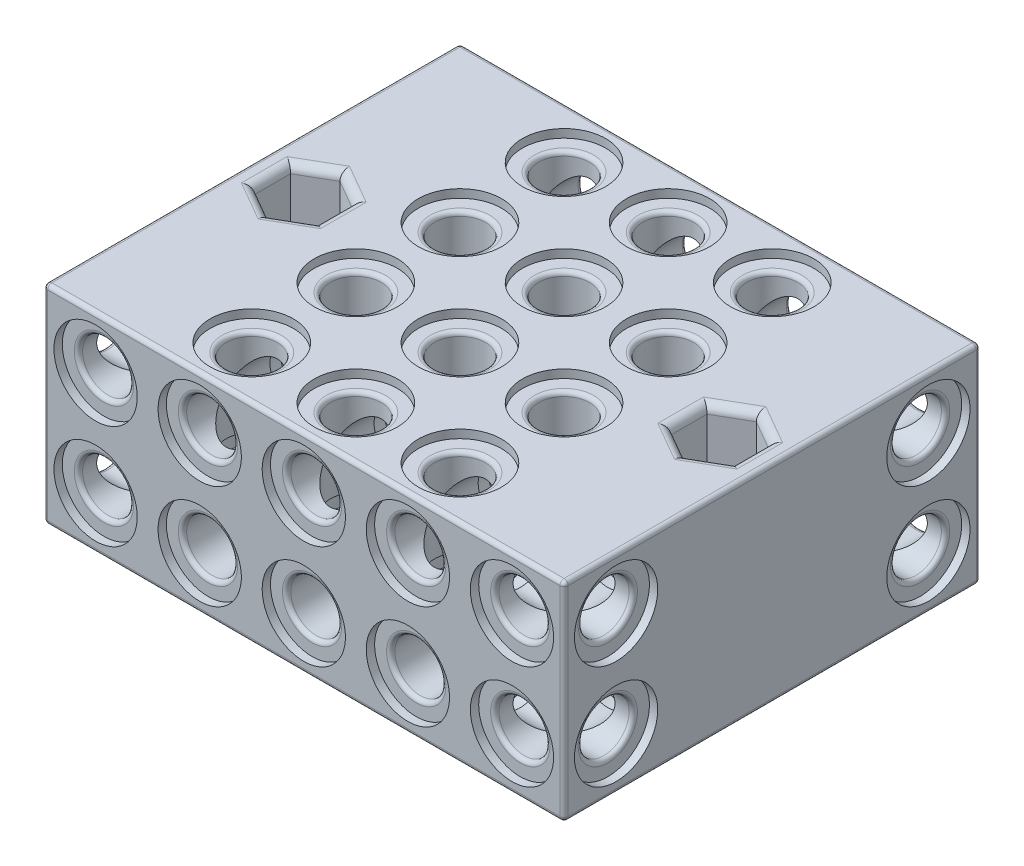
from build123d import *

# Parameters (mm, degrees)
SKETCH1_W              = 50
SKETCH1_H              = 40
BOSS_EXTRUDE1_DEPTH    = 20
SKETCH2_R              = 1.6
CUT_EXTRUDE1_DEPTH     = 38.749172176
CUT_EXTRUDE2_DEPTH     = 17
SKETCH4_R              = 2.45
CUT_EXTRUDE3_DEPTH     = 9.2
SKETCH6_R              = 3
CUT_EXTRUDE5_DEPTH     = 1.5
SKETCH7_R              = 4
CUT_EXTRUDE6_DEPTH     = 0.8
FILLET1_R              = 0.4
LPATTERN1_COUNT        = 4
LPATTERN1_PITCH        = 10
LPATTERN1_COUNT_DIR2   = 2
LPATTERN1_PITCH_DIR2   = 10
FILLET1_OF_LPATTERN1_R = 0.4
SKETCH5_R              = 2.45
CUT_EXTRUDE4_DEPTH     = 9.2
SKETCH8_R              = 3
CUT_EXTRUDE7_DEPTH     = 1.5
SKETCH9_R              = 4
CUT_EXTRUDE8_DEPTH     = 0.8
FILLET2_R              = 0.4
LPATTERN2_COUNT        = 5
LPATTERN2_PITCH        = 10
LPATTERN2_COUNT_DIR2   = 2
LPATTERN2_PITCH_DIR2   = 10
FILLET2_OF_LPATTERN2_R = 0.4
MIRROR2_START          = 9.3
MIRROR2_OUTLINE_R      = 2.45
MIRROR2_DEPTH          = 8.1500001
MIRROR2_2_OUTLINE_R    = 3
MIRROR2_2_OUTLINE_R_2  = 2.45
MIRROR2_2_DEPTH        = 1.5
FILLET3_R              = 0.8
SKETCH10_R             = 2.45
CUT_EXTRUDE9_DEPTH     = 9.2
SKETCH11_R             = 3
CUT_EXTRUDE10_DEPTH    = 1.5
SKETCH12_R             = 4
CUT_EXTRUDE11_DEPTH    = 0.8
FILLET4_R              = 0.4
LPATTERN3_COUNT        = 3
LPATTERN3_PITCH        = 10
LPATTERN3_COUNT_DIR2   = 4
LPATTERN3_PITCH_DIR2   = 10
FILLET4_OF_LPATTERN3_R = 0.4
FILLET5_R              = 0.4


# Read off the part's stored shape, not the designer's step: Mirror1, Mirror2
with BuildPart() as part:
    # Sketch1 → Boss-Extrude1 (new body)
    with BuildSketch(Plane(origin=(0, 0, 0), x_dir=(1, 0, 0), z_dir=(0, 1, 0))):
        Rectangle(SKETCH1_W, SKETCH1_H)
    extrude(amount=BOSS_EXTRUDE1_DEPTH)

    # Sketch2 → Cut-Extrude1 (cut, through all)
    with BuildSketch(Plane.XZ):
        with Locations(Location((-20, 0, 0), (0, 0, 270))):
            Circle(SKETCH2_R)
        with Locations(Location((20, 0, 0), (0, 0, 270))):
            Circle(SKETCH2_R)
    extrude(amount=-CUT_EXTRUDE1_DEPTH, mode=Mode.SUBTRACT)

    # Sketch3 → Cut-Extrude2 (cut)
    with BuildSketch(Plane(origin=(0, 20, 0), x_dir=(1, 0, 0), z_dir=(0, 1, 0))):
        Polygon((-20, 3.464101615), (-23, 1.732050808), (-23, -1.732050808), (-20, -3.464101615), (-17, -1.732050808), (-17, 1.732050808), align=None)
        Polygon((17, 1.732050808), (17, -1.732050808), (20, -3.464101615), (23, -1.732050808), (23, 1.732050808), (20, 3.464101615), align=None)
    extrude(amount=-CUT_EXTRUDE2_DEPTH, mode=Mode.SUBTRACT)

    # Sketch4 → Cut-Extrude3 (cut)
    with BuildSketch(Plane.ZY.offset(25)):
        with Locations((-15, 15)):
            Circle(SKETCH4_R)
    cut_extrude3 = extrude(amount=-CUT_EXTRUDE3_DEPTH, mode=Mode.SUBTRACT)

    # Sketch6 → Cut-Extrude5 (cut)
    with BuildSketch(Plane.ZY.offset(15.8)):
        with Locations((-15, 15)):
            Circle(SKETCH6_R)
    cut_extrude5 = extrude(amount=-CUT_EXTRUDE5_DEPTH, mode=Mode.SUBTRACT)

    # Sketch7 → Cut-Extrude6 (cut)
    with BuildSketch(Plane.ZY.offset(25)):
        with Locations((-15, 15)):
            Circle(SKETCH7_R)
    cut_extrude6 = extrude(amount=-CUT_EXTRUDE6_DEPTH, mode=Mode.SUBTRACT)

    # Fillet1
    fillet1_edges = [part.edges().sort_by_distance(p)[0] for p in [
        (-24.2, 15, -17.45),
    ]]
    fillet(fillet1_edges, radius=FILLET1_R)

    # LPattern1: Cut-Extrude3, Cut-Extrude5, Cut-Extrude6 4 × 2, 4 skipped
    with Locations(*[(0, -j * LPATTERN1_PITCH_DIR2, i * LPATTERN1_PITCH) for i in range(LPATTERN1_COUNT) for j in range(LPATTERN1_COUNT_DIR2) if (i, j) not in ((0, 0), (1, 0), (1, 1), (2, 0), (2, 1))]):
        add(cut_extrude3, mode=Mode.SUBTRACT)
        add(cut_extrude5, mode=Mode.SUBTRACT)
        add(cut_extrude6, mode=Mode.SUBTRACT)

    # Fillet1 of LPattern1
    fillet1_of_lpattern1_edges = [part.edges().sort_by_distance(p)[0] for p in [
        (-24.2, 5, -17.45),
        (-24.2, 15, 12.55),
        (-24.2, 5, 12.55),
    ]]
    fillet(fillet1_of_lpattern1_edges, radius=FILLET1_OF_LPATTERN1_R)

    # Mirror1 outline → Mirror1 (revolve, cut)
    with BuildSketch(Plane(origin=(0, 15, -15), x_dir=(0, 1, 0), z_dir=(0, 0, -1))):
        with BuildLine():
            Line((4, 24.2), (4, 25))
            Line((4, 25), (0, 25))
            Line((0, 25), (0, 14.3))
            Line((0, 14.3), (3, 14.3))
            Line((3, 14.3), (3, 15.8))
            Line((3, 15.8), (2.45, 15.8))
            Line((2.45, 15.8), (2.45, 23.8))
            ThreePointArc((2.45, 23.8), (2.567157288, 24.082842712), (2.85, 24.2))
            Line((2.85, 24.2), (4, 24.2))
        make_face()
    revolve(axis=Axis((0, 15, -15), (1, 0, 0)), mode=Mode.SUBTRACT)

    # Mirror1 2 outline → Mirror1 2 (revolve, cut)
    with BuildSketch(Plane(origin=(0, 5, -15), x_dir=(0, 1, 0), z_dir=(0, 0, -1))):
        with BuildLine():
            Line((4, 24.2), (4, 25))
            Line((4, 25), (0, 25))
            Line((0, 25), (0, 14.3))
            Line((0, 14.3), (3, 14.3))
            Line((3, 14.3), (3, 15.8))
            Line((3, 15.8), (2.45, 15.8))
            Line((2.45, 15.8), (2.45, 23.8))
            ThreePointArc((2.45, 23.8), (2.567157288, 24.082842712), (2.85, 24.2))
            Line((2.85, 24.2), (4, 24.2))
        make_face()
    revolve(axis=Axis((0, 5, -15), (1, 0, 0)), mode=Mode.SUBTRACT)

    # Mirror1 3 outline → Mirror1 3 (revolve, cut)
    with BuildSketch(Plane(origin=(0, 15, 15), x_dir=(0, 1, 0), z_dir=(0, 0, -1))):
        with BuildLine():
            Line((4, 24.2), (4, 25))
            Line((4, 25), (0, 25))
            Line((0, 25), (0, 14.3))
            Line((0, 14.3), (3, 14.3))
            Line((3, 14.3), (3, 15.8))
            Line((3, 15.8), (2.45, 15.8))
            Line((2.45, 15.8), (2.45, 23.8))
            ThreePointArc((2.45, 23.8), (2.567157288, 24.082842712), (2.85, 24.2))
            Line((2.85, 24.2), (4, 24.2))
        make_face()
    revolve(axis=Axis((0, 15, 15), (1, 0, 0)), mode=Mode.SUBTRACT)

    # Mirror1 4 outline → Mirror1 4 (revolve, cut)
    with BuildSketch(Plane(origin=(0, 5, 15), x_dir=(0, 1, 0), z_dir=(0, 0, -1))):
        with BuildLine():
            Line((4, 24.2), (4, 25))
            Line((4, 25), (0, 25))
            Line((0, 25), (0, 14.3))
            Line((0, 14.3), (3, 14.3))
            Line((3, 14.3), (3, 15.8))
            Line((3, 15.8), (2.45, 15.8))
            Line((2.45, 15.8), (2.45, 23.8))
            ThreePointArc((2.45, 23.8), (2.567157288, 24.082842712), (2.85, 24.2))
            Line((2.85, 24.2), (4, 24.2))
        make_face()
    revolve(axis=Axis((0, 5, 15), (1, 0, 0)), mode=Mode.SUBTRACT)

    # Sketch5 → Cut-Extrude4 (cut)
    with BuildSketch(Plane(origin=(0, 0, -20), x_dir=(-1, 0, 0), z_dir=(0, 0, -1))):
        with Locations((20, 15)):
            Circle(SKETCH5_R)
    cut_extrude4 = extrude(amount=-CUT_EXTRUDE4_DEPTH, mode=Mode.SUBTRACT)

    # Sketch8 → Cut-Extrude7 (cut)
    with BuildSketch(Plane(origin=(0, 0, -10.8), x_dir=(-1, 0, 0), z_dir=(0, 0, -1))):
        with Locations((20, 15)):
            Circle(SKETCH8_R)
    cut_extrude7 = extrude(amount=-CUT_EXTRUDE7_DEPTH, mode=Mode.SUBTRACT)

    # Sketch9 → Cut-Extrude8 (cut)
    with BuildSketch(Plane(origin=(0, 0, -20), x_dir=(-1, 0, 0), z_dir=(0, 0, -1))):
        with Locations((20, 15)):
            Circle(SKETCH9_R)
    cut_extrude8 = extrude(amount=-CUT_EXTRUDE8_DEPTH, mode=Mode.SUBTRACT)

    # Fillet2
    fillet2_edges = [part.edges().sort_by_distance(p)[0] for p in [
        (-17.55, 15, -19.2),
    ]]
    fillet(fillet2_edges, radius=FILLET2_R)

    # LPattern2: Cut-Extrude4, Cut-Extrude7, Cut-Extrude8 5 × 2
    with Locations(*[(i * LPATTERN2_PITCH, -j * LPATTERN2_PITCH_DIR2, 0) for i in range(LPATTERN2_COUNT) for j in range(LPATTERN2_COUNT_DIR2) if (i, j) != (0, 0)]):
        add(cut_extrude4, mode=Mode.SUBTRACT)
        add(cut_extrude7, mode=Mode.SUBTRACT)
        add(cut_extrude8, mode=Mode.SUBTRACT)

    # Fillet2 of LPattern2
    fillet2_of_lpattern2_edges = [part.edges().sort_by_distance(p)[0] for p in [
        (-17.55, 5, -19.2),
        (-7.55, 15, -19.2),
        (-7.55, 5, -19.2),
        (2.45, 15, -19.2),
        (2.45, 5, -19.2),
        (12.45, 15, -19.2),
        (12.45, 5, -19.2),
        (22.45, 15, -19.2),
        (22.45, 5, -19.2),
    ]]
    fillet(fillet2_of_lpattern2_edges, radius=FILLET2_OF_LPATTERN2_R)

    # Mirror2 outline → Mirror2 (cut)
    with BuildSketch(Plane.XY.offset(MIRROR2_START)):
        with Locations((20, 5)):
            Circle(MIRROR2_OUTLINE_R)
        with Locations((20, 15)):
            Circle(MIRROR2_OUTLINE_R)
        with Locations((-20, 5)):
            Circle(MIRROR2_OUTLINE_R)
        with Locations((-20, 15)):
            Circle(MIRROR2_OUTLINE_R)
    extrude(amount=MIRROR2_DEPTH, mode=Mode.SUBTRACT)

    # Mirror2 2 outline → Mirror2 2 (cut)
    # profile 1 of 4: a face of its own
    with BuildSketch(Plane.XY.offset(MIRROR2_START)):
        with Locations((20, 5)):
            Circle(MIRROR2_2_OUTLINE_R)
        with Locations((20, 5)):
            Circle(MIRROR2_2_OUTLINE_R_2, mode=Mode.SUBTRACT)
    # profile 2 of 4: a face of its own
    with BuildSketch(Plane.XY.offset(MIRROR2_START)):
        with Locations((20, 15)):
            Circle(MIRROR2_2_OUTLINE_R)
        with Locations((20, 15)):
            Circle(MIRROR2_2_OUTLINE_R_2, mode=Mode.SUBTRACT)
    # profile 3 of 4: a face of its own
    with BuildSketch(Plane.XY.offset(MIRROR2_START)):
        with Locations((-20, 5)):
            Circle(MIRROR2_2_OUTLINE_R)
        with Locations((-20, 5)):
            Circle(MIRROR2_2_OUTLINE_R_2, mode=Mode.SUBTRACT)
    # profile 4 of 4: a face of its own
    with BuildSketch(Plane.XY.offset(MIRROR2_START)):
        with Locations((-20, 15)):
            Circle(MIRROR2_2_OUTLINE_R)
        with Locations((-20, 15)):
            Circle(MIRROR2_2_OUTLINE_R_2, mode=Mode.SUBTRACT)
    extrude(amount=MIRROR2_2_DEPTH, mode=Mode.SUBTRACT)

    # Mirror2 3 outline → Mirror2 3 (revolve, cut)
    with BuildSketch(Plane(origin=(20, 5, 0), x_dir=(1, 0, 0), z_dir=(0, -1, 0))):
        with BuildLine():
            Line((0, 20), (0, 12.993411108))
            Line((0, 12.993411108), (2.45, 12.993411108))
            Line((2.45, 12.993411108), (2.45, 18.8))
            ThreePointArc((2.45, 18.8), (2.567157288, 19.082842712), (2.85, 19.2))
            Line((2.85, 19.2), (4, 19.2))
            Line((4, 19.2), (4, 20))
            Line((4, 20), (0, 20))
        make_face()
    revolve(axis=Axis((20, 5, 0), (0, 0, 1)), mode=Mode.SUBTRACT)

    # Mirror2 4 outline → Mirror2 4 (revolve, cut)
    with BuildSketch(Plane(origin=(20, 15, 0), x_dir=(1, 0, 0), z_dir=(0, -1, 0))):
        with BuildLine():
            Line((0, 20), (0, 12.993411108))
            Line((0, 12.993411108), (2.45, 12.993411108))
            Line((2.45, 12.993411108), (2.45, 18.8))
            ThreePointArc((2.45, 18.8), (2.567157288, 19.082842712), (2.85, 19.2))
            Line((2.85, 19.2), (4, 19.2))
            Line((4, 19.2), (4, 20))
            Line((4, 20), (0, 20))
        make_face()
    revolve(axis=Axis((20, 15, 0), (0, 0, 1)), mode=Mode.SUBTRACT)

    # Mirror2 5 outline → Mirror2 5 (revolve, cut)
    with BuildSketch(Plane(origin=(-20, 5, 0), x_dir=(1, 0, 0), z_dir=(0, -1, 0))):
        with BuildLine():
            Line((0, 20), (0, 12.550363067))
            Line((0, 12.550363067), (2.45, 12.550363067))
            Line((2.45, 12.550363067), (2.45, 18.8))
            ThreePointArc((2.45, 18.8), (2.567157288, 19.082842712), (2.85, 19.2))
            Line((2.85, 19.2), (4, 19.2))
            Line((4, 19.2), (4, 20))
            Line((4, 20), (0, 20))
        make_face()
    revolve(axis=Axis((-20, 5, 0), (0, 0, 1)), mode=Mode.SUBTRACT)

    # Mirror2 6 outline → Mirror2 6 (revolve, cut)
    with BuildSketch(Plane(origin=(-20, 15, 0), x_dir=(1, 0, 0), z_dir=(0, -1, 0))):
        with BuildLine():
            Line((0, 20), (0, 12.550363067))
            Line((0, 12.550363067), (2.45, 12.550363067))
            Line((2.45, 12.550363067), (2.45, 18.8))
            ThreePointArc((2.45, 18.8), (2.567157288, 19.082842712), (2.85, 19.2))
            Line((2.85, 19.2), (4, 19.2))
            Line((4, 19.2), (4, 20))
            Line((4, 20), (0, 20))
        make_face()
    revolve(axis=Axis((-20, 15, 0), (0, 0, 1)), mode=Mode.SUBTRACT)

    # Mirror2 7 outline → Mirror2 7 (revolve, cut)
    with BuildSketch(Plane(origin=(-10, 15, 0), x_dir=(1, 0, 0), z_dir=(0, -1, 0))):
        with BuildLine():
            Line((4, 19.2), (4, 20))
            Line((4, 20), (0, 20))
            Line((0, 20), (0, 9.3))
            Line((0, 9.3), (3, 9.3))
            Line((3, 9.3), (3, 10.8))
            Line((3, 10.8), (2.45, 10.8))
            Line((2.45, 10.8), (2.45, 18.8))
            ThreePointArc((2.45, 18.8), (2.567157288, 19.082842712), (2.85, 19.2))
            Line((2.85, 19.2), (4, 19.2))
        make_face()
    revolve(axis=Axis((-10, 15, 0), (0, 0, 1)), mode=Mode.SUBTRACT)

    # Mirror2 8 outline → Mirror2 8 (revolve, cut)
    with BuildSketch(Plane(origin=(-10, 5, 0), x_dir=(1, 0, 0), z_dir=(0, -1, 0))):
        with BuildLine():
            Line((4, 19.2), (4, 20))
            Line((4, 20), (0, 20))
            Line((0, 20), (0, 9.3))
            Line((0, 9.3), (3, 9.3))
            Line((3, 9.3), (3, 10.8))
            Line((3, 10.8), (2.45, 10.8))
            Line((2.45, 10.8), (2.45, 18.8))
            ThreePointArc((2.45, 18.8), (2.567157288, 19.082842712), (2.85, 19.2))
            Line((2.85, 19.2), (4, 19.2))
        make_face()
    revolve(axis=Axis((-10, 5, 0), (0, 0, 1)), mode=Mode.SUBTRACT)

    # Mirror2 9 outline → Mirror2 9 (revolve, cut)
    with BuildSketch(Plane.XZ.offset(-15)):
        with BuildLine():
            Line((4, 19.2), (4, 20))
            Line((4, 20), (0, 20))
            Line((0, 20), (0, 9.3))
            Line((0, 9.3), (3, 9.3))
            Line((3, 9.3), (3, 10.8))
            Line((3, 10.8), (2.45, 10.8))
            Line((2.45, 10.8), (2.45, 18.8))
            ThreePointArc((2.45, 18.8), (2.567157288, 19.082842712), (2.85, 19.2))
            Line((2.85, 19.2), (4, 19.2))
        make_face()
    revolve(axis=Axis((0, 15, 0), (0, 0, 1)), mode=Mode.SUBTRACT)

    # Mirror2 10 outline → Mirror2 10 (revolve, cut)
    with BuildSketch(Plane.XZ.offset(-5)):
        with BuildLine():
            Line((4, 19.2), (4, 20))
            Line((4, 20), (0, 20))
            Line((0, 20), (0, 9.3))
            Line((0, 9.3), (3, 9.3))
            Line((3, 9.3), (3, 10.8))
            Line((3, 10.8), (2.45, 10.8))
            Line((2.45, 10.8), (2.45, 18.8))
            ThreePointArc((2.45, 18.8), (2.567157288, 19.082842712), (2.85, 19.2))
            Line((2.85, 19.2), (4, 19.2))
        make_face()
    revolve(axis=Axis((0, 5, 0), (0, 0, 1)), mode=Mode.SUBTRACT)

    # Mirror2 11 outline → Mirror2 11 (revolve, cut)
    with BuildSketch(Plane(origin=(10, 15, 0), x_dir=(1, 0, 0), z_dir=(0, -1, 0))):
        with BuildLine():
            Line((4, 19.2), (4, 20))
            Line((4, 20), (0, 20))
            Line((0, 20), (0, 9.3))
            Line((0, 9.3), (3, 9.3))
            Line((3, 9.3), (3, 10.8))
            Line((3, 10.8), (2.45, 10.8))
            Line((2.45, 10.8), (2.45, 18.8))
            ThreePointArc((2.45, 18.8), (2.567157288, 19.082842712), (2.85, 19.2))
            Line((2.85, 19.2), (4, 19.2))
        make_face()
    revolve(axis=Axis((10, 15, 0), (0, 0, 1)), mode=Mode.SUBTRACT)

    # Mirror2 12 outline → Mirror2 12 (revolve, cut)
    with BuildSketch(Plane(origin=(10, 5, 0), x_dir=(1, 0, 0), z_dir=(0, -1, 0))):
        with BuildLine():
            Line((4, 19.2), (4, 20))
            Line((4, 20), (0, 20))
            Line((0, 20), (0, 9.3))
            Line((0, 9.3), (3, 9.3))
            Line((3, 9.3), (3, 10.8))
            Line((3, 10.8), (2.45, 10.8))
            Line((2.45, 10.8), (2.45, 18.8))
            ThreePointArc((2.45, 18.8), (2.567157288, 19.082842712), (2.85, 19.2))
            Line((2.85, 19.2), (4, 19.2))
        make_face()
    revolve(axis=Axis((10, 5, 0), (0, 0, 1)), mode=Mode.SUBTRACT)

    # Fillet3
    fillet3_edges = [part.edges().sort_by_distance(p)[0] for p in [
        (-18.5, 20, -2.598076211),
        (-21.5, 20, -2.598076211),
        (-23, 20, 0),
        (-21.5, 20, 2.598076211),
        (-18.5, 20, 2.598076211),
        (-17, 20, 0),
        (18.5, 20, -2.598076211),
        (17, 20, 0),
        (18.5, 20, 2.598076211),
        (21.5, 20, 2.598076211),
        (23, 20, 0),
        (21.5, 20, -2.598076211),
    ]]
    fillet(fillet3_edges, radius=FILLET3_R)

    # Sketch10 → Cut-Extrude9 (cut)
    with BuildSketch(Plane(origin=(0, 20, 0), x_dir=(1, 0, 0), z_dir=(0, 1, 0))):
        with Locations(Location((-10, 15, 0), (0, 0, 270))):
            Circle(SKETCH10_R)
    cut_extrude9 = extrude(amount=-CUT_EXTRUDE9_DEPTH, mode=Mode.SUBTRACT)

    # Sketch11 → Cut-Extrude10 (cut)
    with BuildSketch(Plane(origin=(0, 10.8, 0), x_dir=(1, 0, 0), z_dir=(0, 1, 0))):
        with Locations(Location((-10, 15, 0), (0, 0, 270))):
            Circle(SKETCH11_R)
    cut_extrude10 = extrude(amount=-CUT_EXTRUDE10_DEPTH, mode=Mode.SUBTRACT)

    # Sketch12 → Cut-Extrude11 (cut)
    with BuildSketch(Plane(origin=(0, 20, 0), x_dir=(1, 0, 0), z_dir=(0, 1, 0))):
        with Locations(Location((-10, 15, 0), (0, 0, 270))):
            Circle(SKETCH12_R)
    cut_extrude11 = extrude(amount=-CUT_EXTRUDE11_DEPTH, mode=Mode.SUBTRACT)

    # Fillet4
    fillet4_edges = [part.edges().sort_by_distance(p)[0] for p in [
        (-10, 19.2, -17.45),
    ]]
    fillet(fillet4_edges, radius=FILLET4_R)

    # LPattern3: Cut-Extrude9, Cut-Extrude10, Cut-Extrude11 3 × 4
    with Locations(*[(i * LPATTERN3_PITCH, 0, j * LPATTERN3_PITCH_DIR2) for i in range(LPATTERN3_COUNT) for j in range(LPATTERN3_COUNT_DIR2) if (i, j) != (0, 0)]):
        add(cut_extrude9, mode=Mode.SUBTRACT)
        add(cut_extrude10, mode=Mode.SUBTRACT)
        add(cut_extrude11, mode=Mode.SUBTRACT)

    # Fillet4 of LPattern3
    fillet4_of_lpattern3_edges = [part.edges().sort_by_distance(p)[0] for p in [
        (-10, 19.2, -7.45),
        (-10, 19.2, 2.55),
        (-10, 19.2, 12.55),
        (0, 19.2, -17.45),
        (0, 19.2, -7.45),
        (0, 19.2, 2.55),
        (0, 19.2, 12.55),
        (10, 19.2, -17.45),
        (10, 19.2, -7.45),
        (10, 19.2, 2.55),
        (10, 19.2, 12.55),
    ]]
    fillet(fillet4_of_lpattern3_edges, radius=FILLET4_OF_LPATTERN3_R)

    # Fillet5
    fillet5_edges = [part.edges().sort_by_distance(p)[0] for p in [
        (-25, 20, 0),
        (0, 20, 20),
        (25, 20, 0),
        (0, 0, 20),
        (-25, 0, 0),
        (0, 0, -20),
        (25, 0, 0),
        (0, 20, -20),
        (25, 10, 20),
        (-25, 10, 20),
        (-25, 10, -20),
        (25, 10, -20),
    ]]
    fillet(fillet5_edges, radius=FILLET5_R)


solid = part.part
